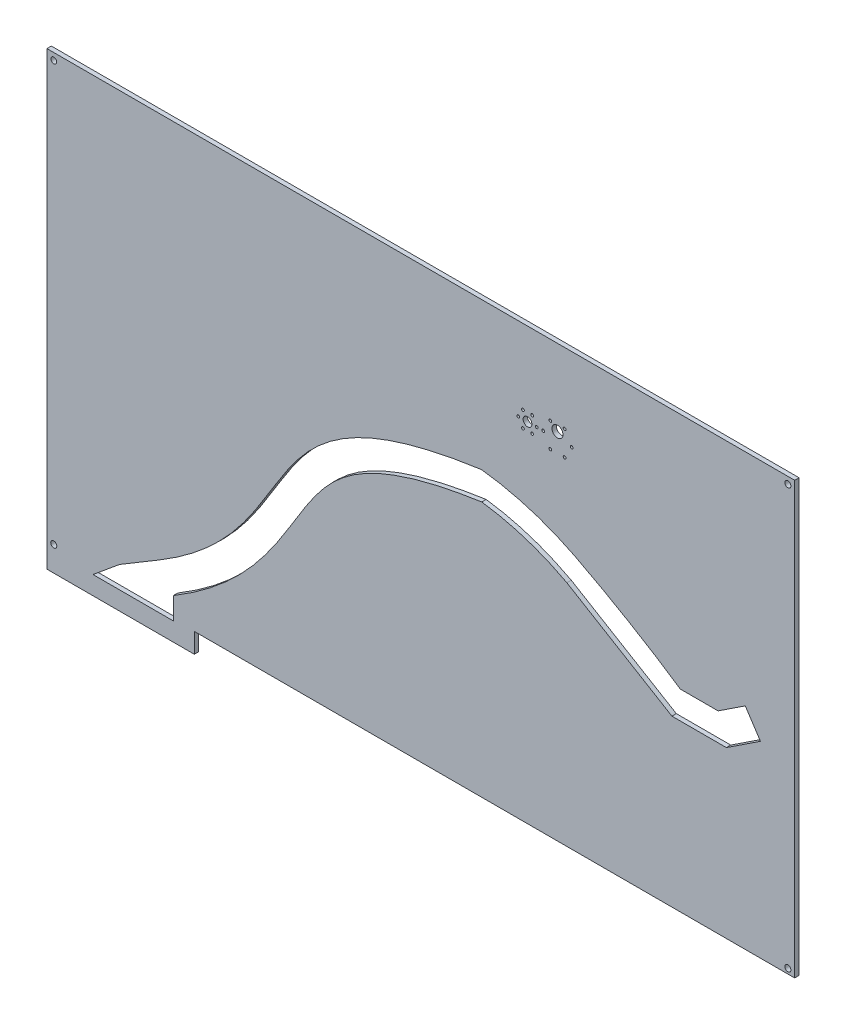
from build123d import *

# Parameters (mm, degrees)
SKETCH1_R           = 3.292374312
SKETCH1_R_2         = 3.294421934
SKETCH1_R_3         = 3.163533699
SKETCH1_R_4         = 1.5
SKETCH1_R_5         = 4.7625
SKETCH1_R_6         = 6
BOSS_EXTRUDE1_DEPTH = 4.7625


with BuildPart() as part:
    # Sketch1 → Boss-Extrude1 (new body)
    with BuildSketch(Plane.XY):
        Polygon((-436.816755826, -147.994392447), (215.080766979, -147.994392447), (215.080766979, 320), (-596.816755826, 320), (-596.816755826, -150), (-596.816755826, -169.55039994), (-436.816755826, -169.55039994), align=None)
        with Locations((-589.375723826, -142.5578)):
            Circle(SKETCH1_R, mode=Mode.SUBTRACT)
        with Locations((207.642212326, -142.5578)):
            Circle(SKETCH1_R, mode=Mode.SUBTRACT)
        with Locations((207.642212326, 312.5578)):
            Circle(SKETCH1_R_2, mode=Mode.SUBTRACT)
        with Locations((-589.375723826, 312.5578)):
            Circle(SKETCH1_R_3, mode=Mode.SUBTRACT)
        with Locations((-85, 230)):
            Circle(SKETCH1_R_4, mode=Mode.SUBTRACT)
        with Locations((-80, 238.660254038)):
            Circle(SKETCH1_R_4, mode=Mode.SUBTRACT)
        with Locations((-70, 238.660254038)):
            Circle(SKETCH1_R_4, mode=Mode.SUBTRACT)
        with Locations((-65, 230)):
            Circle(SKETCH1_R_4, mode=Mode.SUBTRACT)
        with Locations((-70, 221.339745962)):
            Circle(SKETCH1_R_4, mode=Mode.SUBTRACT)
        with Locations((-80, 221.339745962)):
            Circle(SKETCH1_R_4, mode=Mode.SUBTRACT)
        with Locations((-58, 230)):
            Circle(SKETCH1_R_4, mode=Mode.SUBTRACT)
        with Locations((-50.25, 243.423393759)):
            Circle(SKETCH1_R_4, mode=Mode.SUBTRACT)
        with Locations((-34.75, 243.423393759)):
            Circle(SKETCH1_R_4, mode=Mode.SUBTRACT)
        with Locations((-27, 230)):
            Circle(SKETCH1_R_4, mode=Mode.SUBTRACT)
        with Locations((-34.75, 216.576606241)):
            Circle(SKETCH1_R_4, mode=Mode.SUBTRACT)
        with Locations((-50.25, 216.576606241)):
            Circle(SKETCH1_R_4, mode=Mode.SUBTRACT)
        with Locations((-75, 230)):
            Circle(SKETCH1_R_5, mode=Mode.SUBTRACT)
        with Locations((-42.5, 237)):
            Circle(SKETCH1_R_6, mode=Mode.SUBTRACT)
        with BuildLine():
            Line((-475, -100), (-518.031074044, -125.74437106))
            Line((-518.031074044, -125.74437106), (-546.780363752, -149.55039994))
            Line((-546.780363752, -149.55039994), (-459.597813184, -149.55039994))
            Line((-459.597813184, -149.55039994), (-459.597813184, -125.74437106))
            add(Edge.make_bspline(
                [(-459.597813184, -125.74437106), (-458.129207209, -124.865742348), (-455.185829054, -123.081513508), (-449.471359557, -119.524654219), (-442.555549408, -115.046151368), (-434.636214281, -109.639746192), (-424.556425744, -102.386073958), (-412.829398694, -93.24529863), (-400.055778993, -82.1905419), (-388.486450966, -71.092190732), (-374.537420018, -56.304576734), (-359.620141336, -37.979207276), (-344.890774823, -16.767556206), (-332.340078528, 3.245699555), (-321.055163892, 21.796443272), (-310.225956981, 38.664819129), (-299.079604806, 53.834809894), (-286.812791685, 67.514642691), (-272.431751915, 80.088460877), (-257.652665703, 89.924055398), (-243.498210685, 97.442015492), (-231.565093385, 102.886615769), (-218.172694067, 108.112662921), (-203.190999217, 113.087836875), (-189.281720356, 116.996077726), (-177.243425929, 119.962936855), (-167.745823902, 122.104113686), (-157.766000623, 124.157339904), (-149.036898589, 125.791853127), (-141.799270328, 127.051772068), (-136.243143266, 127.972296195), (-131.502167372, 128.719120718), (-127.648712651, 129.303231945), (-125.690331117, 129.592450023), (-124.714693771, 129.734664734)],
                knots=[0, 0, 0, 0, 0.00777259, 0.01554518, 0.03109036, 0.04663554, 0.062180721, 0.093271081, 0.124361441, 0.155451801, 0.186542162, 0.248722882, 0.310903603, 0.373084323, 0.435265044, 0.497445764, 0.559626485, 0.621807206, 0.683987926, 0.746168647, 0.777259007, 0.808349367, 0.839439728, 0.870530088, 0.901620448, 0.917165628, 0.932710808, 0.948255989, 0.963801169, 0.971573759, 0.979346349, 0.987118939, 0.991005234, 0.994891529, 0.994891529, 0.994891529, 0.994891529], degree=3))
            ThreePointArc((-124.714693771, 129.734664734), (-77.172123272, 119.052933104), (-32.323699215, 100))
            Line((-32.323699215, 100), (81.77450832, 31.56416045))
            Line((81.77450832, 31.56416045), (140.88780849, 31.56416045))
            Line((140.88780849, 31.56416045), (177.923308763, 55.973921994))
            Line((177.923308763, 55.973921994), (161.413907899, 81.022668132))
            Line((161.413907899, 81.022668132), (131.890654865, 61.56416045))
            Line((131.890654865, 61.56416045), (90.97120992, 61.56416045))
            ThreePointArc((90.97120992, 61.56416045), (35.57180112, 96.520479224), (-21.701372103, 128.313911667))
            Line((-21.701372103, 128.313911667), (-25, 130))
            ThreePointArc((-25, 130), (-73.684930832, 149.383563894), (-125, 160))
            add(Edge.make_bspline(
                [(-475, -100), (-419.540575809, -66.820070684), (-329.590802121, 43.11603253), (-307.635554762, 134.287094016), (-125, 160)],
                knots=[0, 0, 0, 0, 0.312223899, 1, 1, 1, 1], degree=3))
        make_face(mode=Mode.SUBTRACT)
    extrude(amount=BOSS_EXTRUDE1_DEPTH)


solid = part.part
